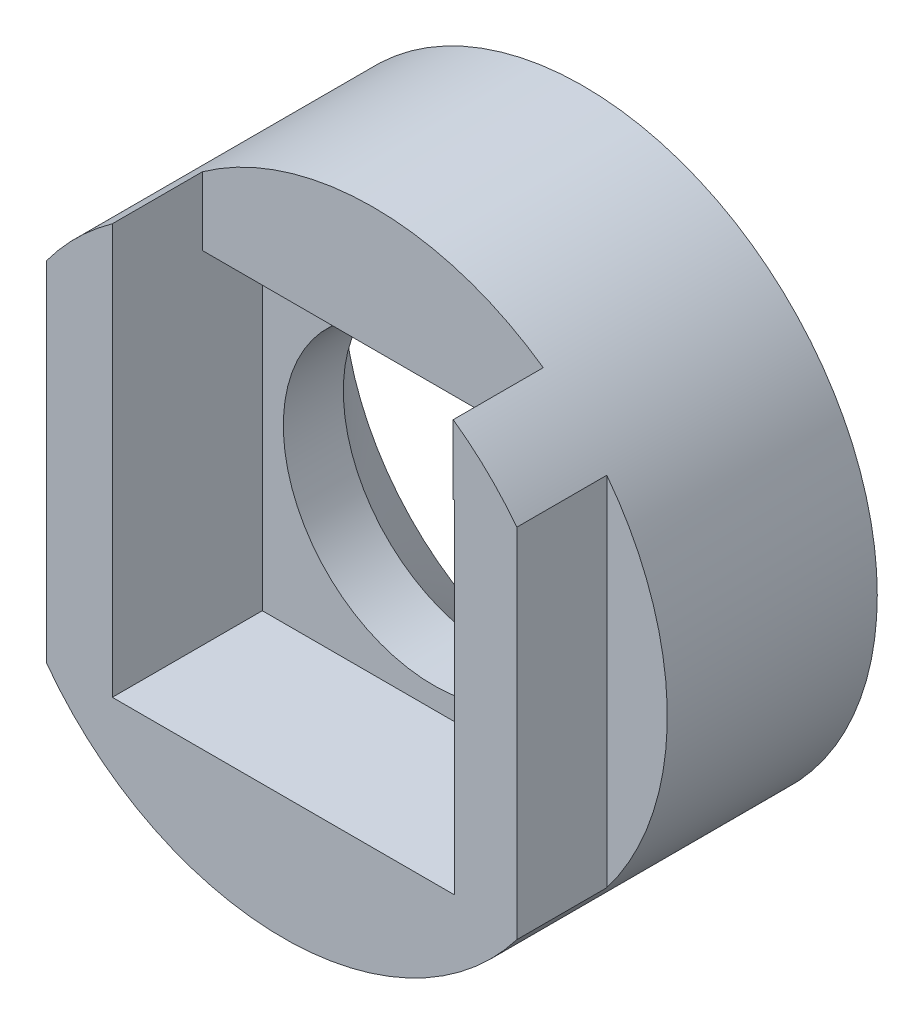
from build123d import *

# Parameters (mm, degrees)
SKETCH1_R           = 9.8
SKETCH1_R_2         = 5
BOSS_EXTRUDE1_DEPTH = 10
SKETCH2_W           = 11.4
SKETCH2_H           = 11.4
CUT_EXTRUDE1_DEPTH  = 5
SKETCH3_W           = 11.363408722
SKETCH3_H           = 4.657055676
CUT_EXTRUDE2_DEPTH  = 3
SKETCH4_W           = 5.404805584
SKETCH4_H           = 18.076359344
SKETCH4_W_2         = 5.663408722
SKETCH4_H_2         = 17.947057775
CUT_EXTRUDE3_DEPTH  = 3
CHAMFER1_SIZE       = 3


with BuildPart() as part:
    # Sketch1 → Boss-Extrude1 (new body)
    with BuildSketch(Plane.XY):
        Circle(SKETCH1_R)
        Circle(SKETCH1_R_2, mode=Mode.SUBTRACT)
    extrude(amount=BOSS_EXTRUDE1_DEPTH)

    # Sketch2 → Cut-Extrude1 (cut)
    with BuildSketch(Plane.XY.offset(10)):
        Rectangle(SKETCH2_W, SKETCH2_H)
    extrude(amount=-CUT_EXTRUDE1_DEPTH, mode=Mode.SUBTRACT)

    # Sketch3 → Cut-Extrude2 (cut)
    with BuildSketch(Plane.XY.offset(10)):
        with Locations((-0.018295639, 8.028527838)):
            Rectangle(SKETCH3_W, SKETCH3_H)
    extrude(amount=-CUT_EXTRUDE2_DEPTH, mode=Mode.SUBTRACT)

    # Sketch4 → Cut-Extrude3 (cut)
    with BuildSketch(Plane.XY.offset(10)):
        with Locations((-10.5897985, 0)):
            Rectangle(SKETCH4_W, SKETCH4_H)
        with Locations((10.615658814, 0.064650784)):
            Rectangle(SKETCH4_W_2, SKETCH4_H_2)
    extrude(amount=-CUT_EXTRUDE3_DEPTH, mode=Mode.SUBTRACT)

    # Chamfer1
    chamfer1_edges = [part.edges().sort_by_distance(p)[0] for p in [
        (-5, 0, 0),
    ]]
    chamfer(chamfer1_edges, length=CHAMFER1_SIZE)


solid = part.part
